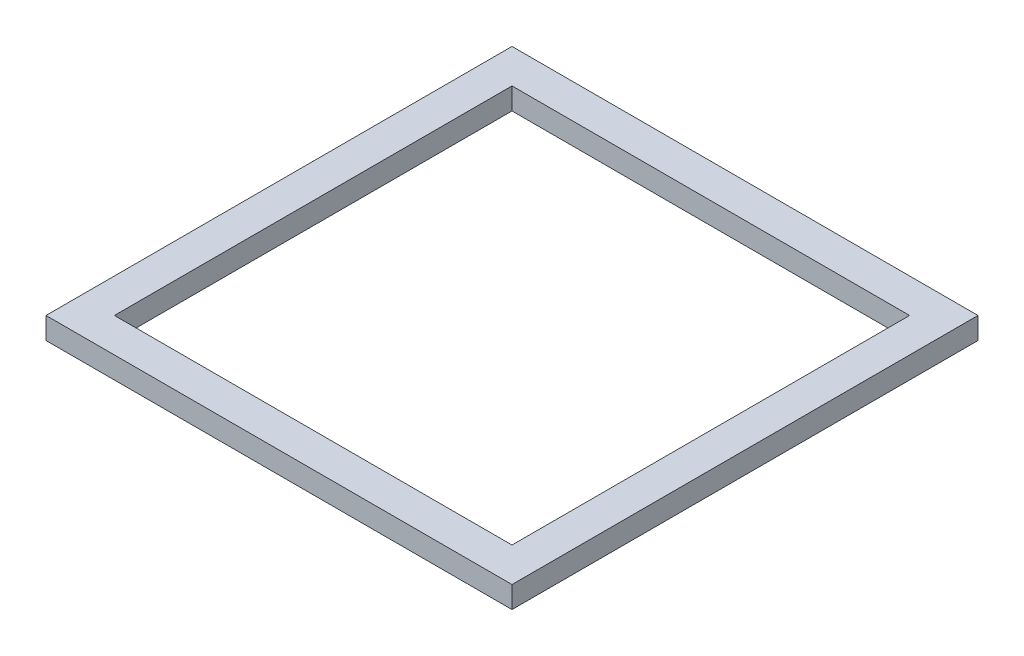
from build123d import *

# Parameters (mm, degrees)
SKETCH1_W           = 272.5
SKETCH1_H           = 272.5
BOSS_EXTRUDE1_DEPTH = 12.7
SKETCH2_W           = 232.5
SKETCH2_H           = 232.5
CUT_EXTRUDE1_DEPTH  = 12.7


with BuildPart() as part:
    # Sketch1 → Boss-Extrude1 (new body)
    with BuildSketch(Plane(origin=(0, 0, 0), x_dir=(1, 0, 0), z_dir=(0, 1, 0))):
        Rectangle(SKETCH1_W, SKETCH1_H)
    extrude(amount=BOSS_EXTRUDE1_DEPTH)

    # Sketch2 → Cut-Extrude1 (cut)
    with BuildSketch(Plane(origin=(0, 12.7, 0), x_dir=(1, 0, 0), z_dir=(0, 1, 0))):
        Rectangle(SKETCH2_W, SKETCH2_H)
    extrude(amount=-CUT_EXTRUDE1_DEPTH, mode=Mode.SUBTRACT)


solid = part.part
